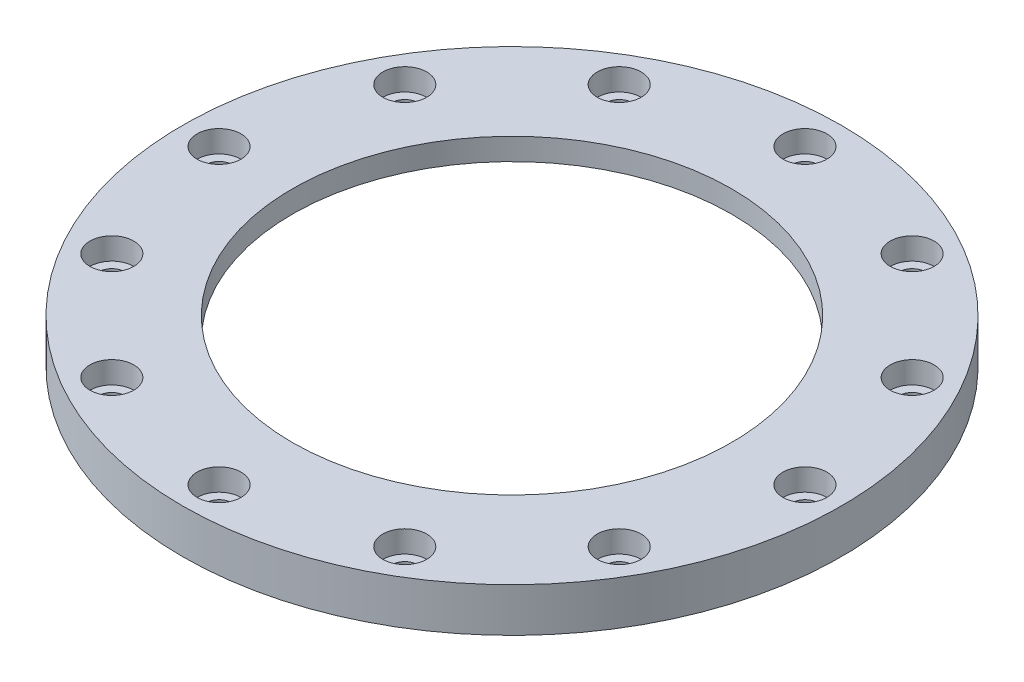
from build123d import *

# Parameters (mm, degrees)
SKETCH1_R           = 45
SKETCH1_R_2         = 30
SKETCH1_R_3         = 1.75
BOSS_EXTRUDE1_DEPTH = 6
SKETCH2_R           = 36
CUT_EXTRUDE1_DEPTH  = 3
SKETCH3_R           = 3
CUT_EXTRUDE2_DEPTH  = 3


with BuildPart() as part:
    # Sketch1 → Boss-Extrude1 (new body)
    with BuildSketch(Plane(origin=(0, 0, 0), x_dir=(1, 0, 0), z_dir=(0, 1, 0))):
        Circle(SKETCH1_R)
        Circle(SKETCH1_R_2, mode=Mode.SUBTRACT)
        with Locations((0, 40)):
            Circle(SKETCH1_R_3, mode=Mode.SUBTRACT)
        with Locations((20, 34.641016151)):
            Circle(SKETCH1_R_3, mode=Mode.SUBTRACT)
        with Locations((34.641016151, 20)):
            Circle(SKETCH1_R_3, mode=Mode.SUBTRACT)
        with Locations((40, 0)):
            Circle(SKETCH1_R_3, mode=Mode.SUBTRACT)
        with Locations((34.641016151, -20)):
            Circle(SKETCH1_R_3, mode=Mode.SUBTRACT)
        with Locations((20, -34.641016151)):
            Circle(SKETCH1_R_3, mode=Mode.SUBTRACT)
        with Locations((0, -40)):
            Circle(SKETCH1_R_3, mode=Mode.SUBTRACT)
        with Locations((-20, -34.641016151)):
            Circle(SKETCH1_R_3, mode=Mode.SUBTRACT)
        with Locations((-34.641016151, -20)):
            Circle(SKETCH1_R_3, mode=Mode.SUBTRACT)
        with Locations((-40, 0)):
            Circle(SKETCH1_R_3, mode=Mode.SUBTRACT)
        with Locations((-34.641016151, 20)):
            Circle(SKETCH1_R_3, mode=Mode.SUBTRACT)
        with Locations((-20, 34.641016151)):
            Circle(SKETCH1_R_3, mode=Mode.SUBTRACT)
    extrude(amount=BOSS_EXTRUDE1_DEPTH)

    # Sketch2 → Cut-Extrude1 (cut)
    with BuildSketch(Plane.XZ):
        Circle(SKETCH2_R)
    extrude(amount=-CUT_EXTRUDE1_DEPTH, mode=Mode.SUBTRACT)

    # Sketch3 → Cut-Extrude2 (cut)
    with BuildSketch(Plane(origin=(0, 6, 0), x_dir=(1, 0, 0), z_dir=(0, 1, 0))):
        with Locations((40, 0)):
            Circle(SKETCH3_R)
        with Locations((34.641016151, -20)):
            Circle(SKETCH3_R)
        with Locations((20, -34.641016151)):
            Circle(SKETCH3_R)
        with Locations((0, -40)):
            Circle(SKETCH3_R)
        with Locations((-20, -34.641016151)):
            Circle(SKETCH3_R)
        with Locations((-34.641016151, -20)):
            Circle(SKETCH3_R)
        with Locations((-40, 0)):
            Circle(SKETCH3_R)
        with Locations((-34.641016151, 20)):
            Circle(SKETCH3_R)
        with Locations((-20, 34.641016151)):
            Circle(SKETCH3_R)
        with Locations((0, 40)):
            Circle(SKETCH3_R)
        with Locations((20, 34.641016151)):
            Circle(SKETCH3_R)
        with Locations((34.641016151, 20)):
            Circle(SKETCH3_R)
    extrude(amount=-CUT_EXTRUDE2_DEPTH, mode=Mode.SUBTRACT)


solid = part.part
